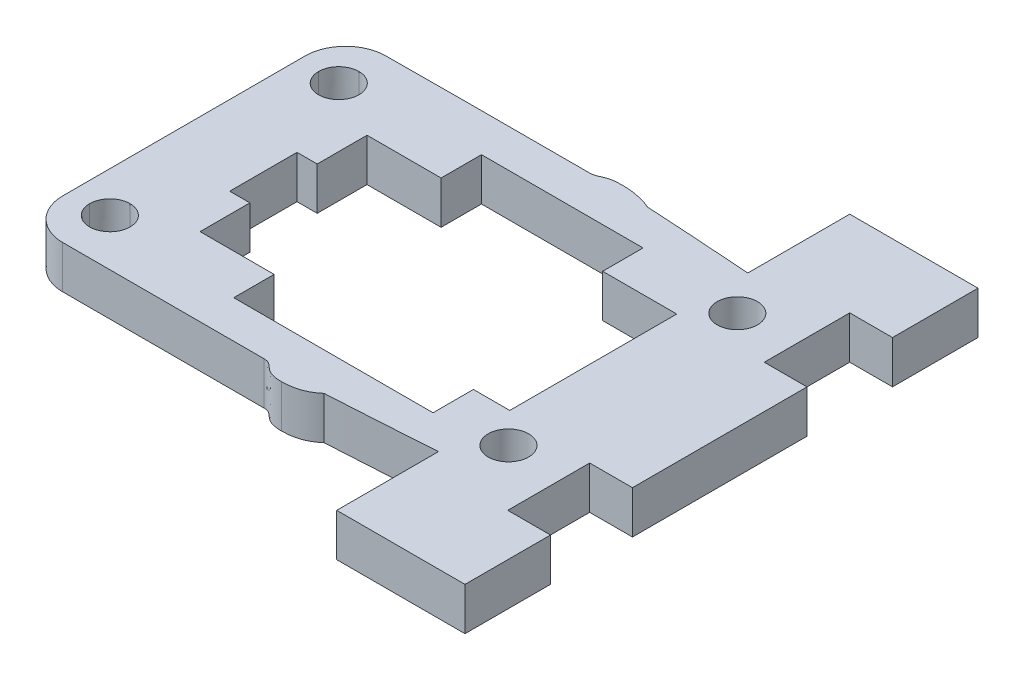
from build123d import *

# Parameters (mm, degrees)
SKETCH1_R           = 1.4998
SKETCH1_R_2         = 1.499900003
BOSS_EXTRUDE1_DEPTH = 3.175


with BuildPart() as part:
    # Sketch1 → Boss-Extrude1 (new body)
    with BuildSketch(Plane(origin=(0, 0, 0), x_dir=(1, 0, 0), z_dir=(0, 1, 0))):
        with BuildLine():
            Line((141.909960584, 37.680418232), (151.434960584, 37.680418232))
            Line((151.434960584, 37.680418232), (151.434960584, 31.330418232))
            Line((151.434960584, 31.330418232), (148.259960584, 31.330418232))
            Line((148.259960584, 31.330418232), (148.259960584, 24.980418232))
            Line((148.259960584, 24.980418232), (151.434960584, 24.980418232))
            Line((151.434960584, 24.980418232), (151.434960584, 12.017671943))
            Line((151.434960584, 12.017671943), (148.259960584, 12.017671943))
            Line((148.259960584, 12.017671943), (148.259960584, 5.930418232))
            Line((148.259960584, 5.930418232), (151.434960584, 5.930418232))
            Line((151.434960584, 5.930418232), (151.434960584, -0.419581768))
            Line((151.434960584, -0.419581768), (141.909960584, -0.419581768))
            Line((141.909960584, -0.419581768), (141.909960584, 7.141331258))
            add(Edge.make_bspline(
                [(141.909960584, 7.141331258), (138.012639459, 6.854681418), (133.909960584, 6.630537226)],
                knots=[0.600435936, 0.600435936, 0.600435936, 0.647058824, 0.647058824, 0.647058824], degree=2))
            add(Edge.make_bspline(
                [(133.909960584, 6.630537226), (132.982260584, 5.801937226), (131.588760584, 5.801937226)],
                knots=[0.647058824, 0.647058824, 0.647058824, 0.705882353, 0.705882353, 0.705882353], degree=2))
            add(Edge.make_bspline(
                [(131.588760584, 5.801937226), (130.078160584, 5.801937226), (130.269860584, 6.630537226), (129.469560584, 6.630537226)],
                knots=[0.705882353, 0.705882353, 0.705882353, 0.705882353, 0.764705882, 0.764705882, 0.764705882, 0.764705882], degree=3))
            add(Edge.make_bspline(
                [(129.469560584, 6.630537226), (123.742760584, 6.630537226), (114.509960584, 6.630537226)],
                knots=[0.764705882, 0.764705882, 0.764705882, 0.823529412, 0.823529412, 0.823529412], degree=2))
            add(Edge.make_bspline(
                [(114.509960584, 6.630537226), (113.714360584, 6.630537226), (112.951360584, 6.946537226), (112.388760584, 7.509137226)],
                knots=[0.823529412, 0.823529412, 0.823529412, 0.823529412, 0.882352941, 0.882352941, 0.882352941, 0.882352941], degree=3))
            add(Edge.make_bspline(
                [(112.388760584, 7.509137226), (111.826160584, 8.071737226), (111.509960584, 8.834837226), (111.509960584, 9.630537226)],
                knots=[0.882352941, 0.882352941, 0.882352941, 0.882352941, 1, 1, 1, 1], degree=3))
            Line((111.509960584, 9.630537226), (111.509960584, 27.630337226))
            add(Edge.make_bspline(
                [(111.509960584, 27.630337226), (111.509960584, 28.425937226), (111.826160584, 29.189037226), (112.388760584, 29.751637226)],
                knots=[0.058823529, 0.058823529, 0.058823529, 0.058823529, 0.117647059, 0.117647059, 0.117647059, 0.117647059], degree=3))
            add(Edge.make_bspline(
                [(112.388760584, 29.751637226), (112.951360584, 30.314237226), (113.714360584, 30.630337226), (114.509960584, 30.630337226)],
                knots=[0.117647059, 0.117647059, 0.117647059, 0.117647059, 0.176470588, 0.176470588, 0.176470588, 0.176470588], degree=3))
            add(Edge.make_bspline(
                [(114.509960584, 30.630337226), (114.497160584, 30.650837226), (123.834160584, 30.675137226), (129.557760584, 30.665837226)],
                knots=[0.176470588, 0.176470588, 0.176470588, 0.176470588, 0.235294118, 0.235294118, 0.235294118, 0.235294118], degree=3))
            add(Edge.make_bspline(
                [(129.557760584, 30.665837226), (130.304960584, 30.664637226), (130.243960584, 31.102237226), (131.588760584, 31.102237226)],
                knots=[0.235294118, 0.235294118, 0.235294118, 0.235294118, 0.294117647, 0.294117647, 0.294117647, 0.294117647], degree=3))
            add(Edge.make_bspline(
                [(131.588760584, 31.102237226), (133.000560584, 31.102237226), (133.900960584, 30.644837226), (133.909960584, 30.630337226)],
                knots=[0.294117647, 0.294117647, 0.294117647, 0.294117647, 0.352941176, 0.352941176, 0.352941176, 0.352941176], degree=3))
            add(Edge.make_bspline(
                [(133.909960584, 30.630337226), (138.015555544, 30.400054544), (141.909960584, 30.103795733)],
                knots=[0.352941176, 0.352941176, 0.352941176, 0.400840894, 0.400840894, 0.400840894], degree=2))
            Line((141.909960584, 30.103795733), (141.909960584, 37.680418232))
        make_face()
        with Locations((144.109960584, 10.130437226)):
            Circle(SKETCH1_R, mode=Mode.SUBTRACT)
        with Locations((144.110060584, 27.130337226)):
            Circle(SKETCH1_R_2, mode=Mode.SUBTRACT)
        Polygon((141.909960584, 24.830337226), (141.909960584, 12.430337226), (139.209960584, 12.430337226), (139.209960584, 9.430537226), (124.409960584, 9.430537226), (124.409960584, 12.430337226), (118.909960584, 12.430337226), (118.909960584, 16.130337226), (117.410060584, 16.130337226), (117.410060584, 21.130337226), (118.909960584, 21.130337226), (118.909960584, 24.830337226), (124.409960584, 24.830337226), (124.409960584, 27.830337226), (136.409960584, 27.830337226), (136.409960584, 24.830337226), align=None, mode=Mode.SUBTRACT)
        with BuildLine():
            add(Edge.make_bspline(
                [(116.009960584, 27.130337226), (116.009960584, 26.301837226), (115.338460584, 25.630337226), (114.510060584, 25.630337226)],
                knots=[0, 0, 0, 0, 0.2, 0.2, 0.2, 0.2], degree=3))
            add(Edge.make_bspline(
                [(114.510060584, 25.630337226), (113.681560584, 25.630237226), (113.010060584, 26.301837226), (113.010060584, 27.130237226)],
                knots=[0.2, 0.2, 0.2, 0.2, 0.4, 0.4, 0.4, 0.4], degree=3))
            add(Edge.make_bspline(
                [(113.010060584, 27.130237226), (113.009960584, 27.958737226), (113.681560584, 28.630237226), (114.509960584, 28.630337226)],
                knots=[0.4, 0.4, 0.4, 0.4, 0.6, 0.6, 0.6, 0.6], degree=3))
            add(Edge.make_bspline(
                [(114.509960584, 28.630337226), (115.338460584, 28.630337226), (116.009960584, 27.958737226), (116.009960584, 27.130337226)],
                knots=[0.6, 0.6, 0.6, 0.6, 1, 1, 1, 1], degree=3))
        make_face(mode=Mode.SUBTRACT)
        with BuildLine():
            add(Edge.make_bspline(
                [(116.009960584, 10.130537226), (116.009960584, 9.302137226), (115.338360584, 8.630437226), (114.510060584, 8.630437226)],
                knots=[0, 0, 0, 0, 0.2, 0.2, 0.2, 0.2], degree=3))
            add(Edge.make_bspline(
                [(114.510060584, 8.630437226), (113.681660584, 8.630437226), (113.009960584, 9.302137226), (113.009960584, 10.130437226)],
                knots=[0.2, 0.2, 0.2, 0.2, 0.4, 0.4, 0.4, 0.4], degree=3))
            add(Edge.make_bspline(
                [(113.009960584, 10.130437226), (113.009960584, 10.958837226), (113.681660584, 11.630337226), (114.509960584, 11.630337226)],
                knots=[0.4, 0.4, 0.4, 0.4, 0.6, 0.6, 0.6, 0.6], degree=3))
            add(Edge.make_bspline(
                [(114.509960584, 11.630337226), (115.338360584, 11.630337226), (116.009960584, 10.958837226), (116.009960584, 10.130537226)],
                knots=[0.6, 0.6, 0.6, 0.6, 1, 1, 1, 1], degree=3))
        make_face(mode=Mode.SUBTRACT)
    extrude(amount=BOSS_EXTRUDE1_DEPTH)


solid = part.part
